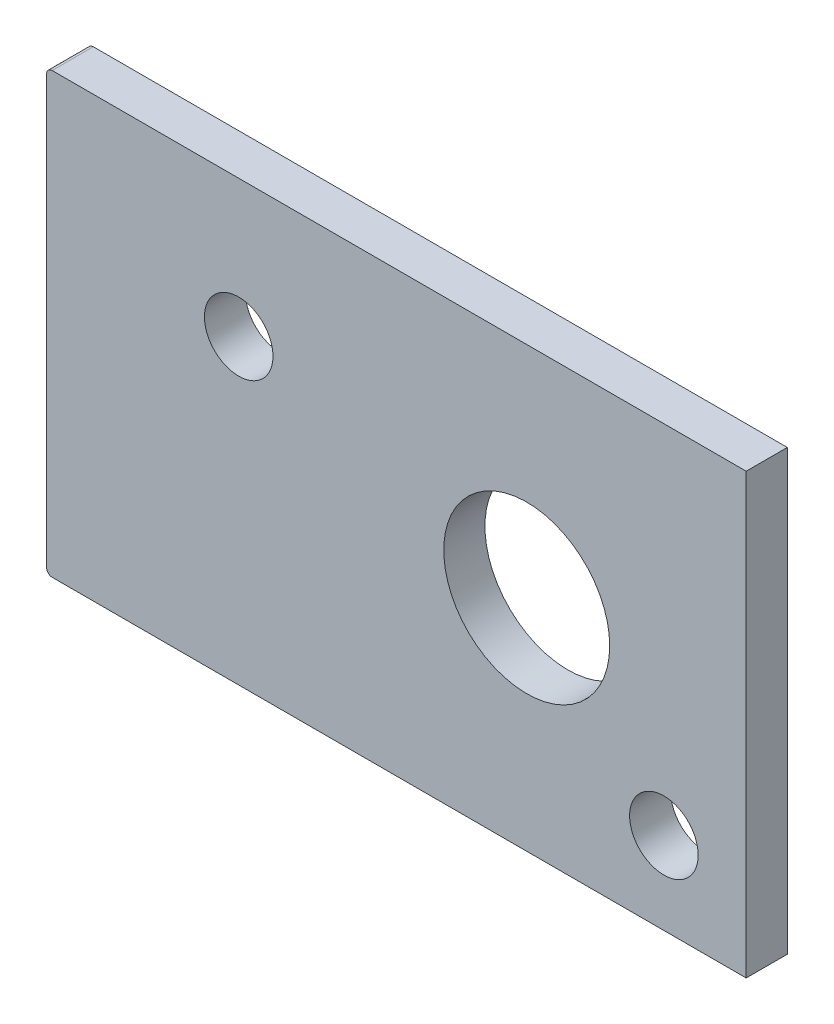
from build123d import *

# Parameters (mm, degrees)
SKETCH1_R          = 1.25
SKETCH1_R_2        = 3.025
BASE_FLANGE1_DEPTH = 1.5


# Sheet-metal steps are written as plain solids
with BuildPart() as part:
    # Sketch1 → Base-Flange1 (new body)
    with BuildSketch(Plane.XY):
        with BuildLine():
            Line((0, 16), (-25.3, 16))
            ThreePointArc((-25.3, 16), (-25.441421356, 15.941421356), (-25.5, 15.8))
            Line((-25.5, 15.8), (-25.5, 0.2))
            ThreePointArc((-25.5, 0.2), (-25.441421356, 0.058578644), (-25.3, 0))
            Line((-25.3, 0), (0, 0))
            Line((0, 0), (0, 16))
        make_face()
        with Locations((-3, 3)):
            Circle(SKETCH1_R, mode=Mode.SUBTRACT)
        with Locations((-8, 8)):
            Circle(SKETCH1_R_2, mode=Mode.SUBTRACT)
        with Locations((-18.5, 11)):
            Circle(SKETCH1_R, mode=Mode.SUBTRACT)
    extrude(amount=-BASE_FLANGE1_DEPTH)


solid = part.part
